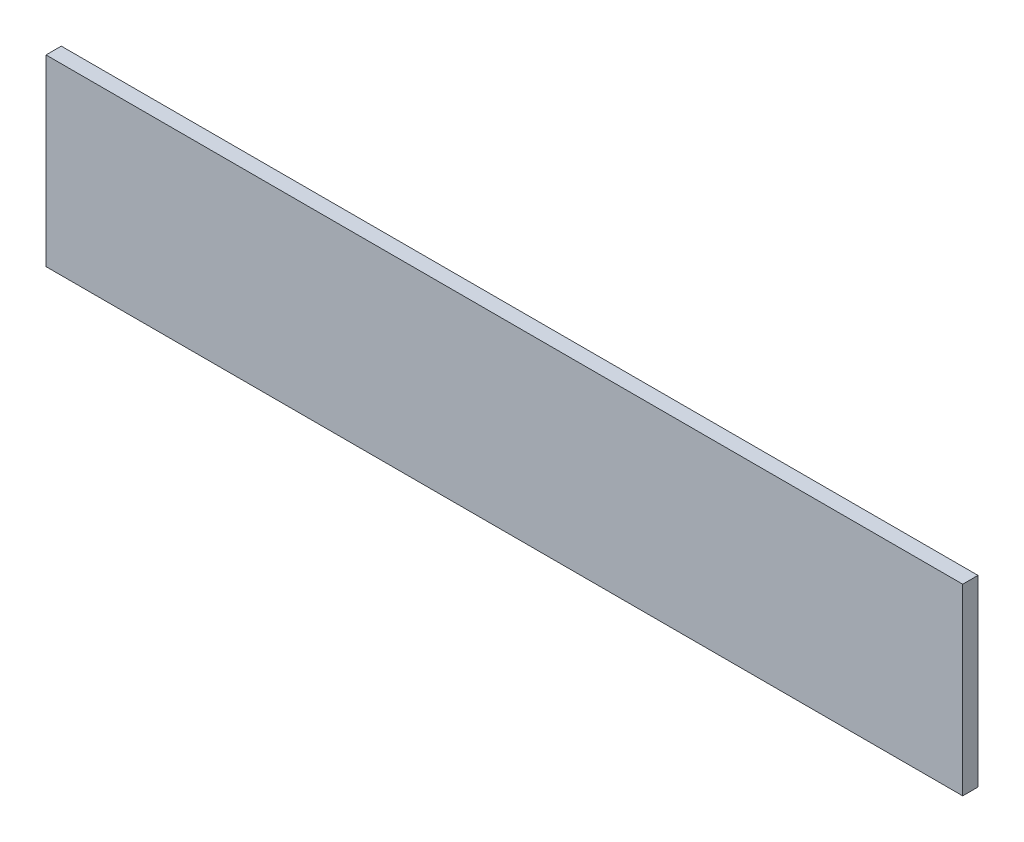
from build123d import *

# Parameters (mm, degrees)
ESQUISSE1_W        = 600
ESQUISSE1_H        = 120
BOSS_EXTRU_1_DEPTH = 10


with BuildPart() as part:
    # Esquisse1 → Boss.-Extru.1 (new body)
    with BuildSketch(Plane.XY):
        with Locations((300, 60)):
            Rectangle(ESQUISSE1_W, ESQUISSE1_H)
    extrude(amount=BOSS_EXTRU_1_DEPTH)


solid = part.part
